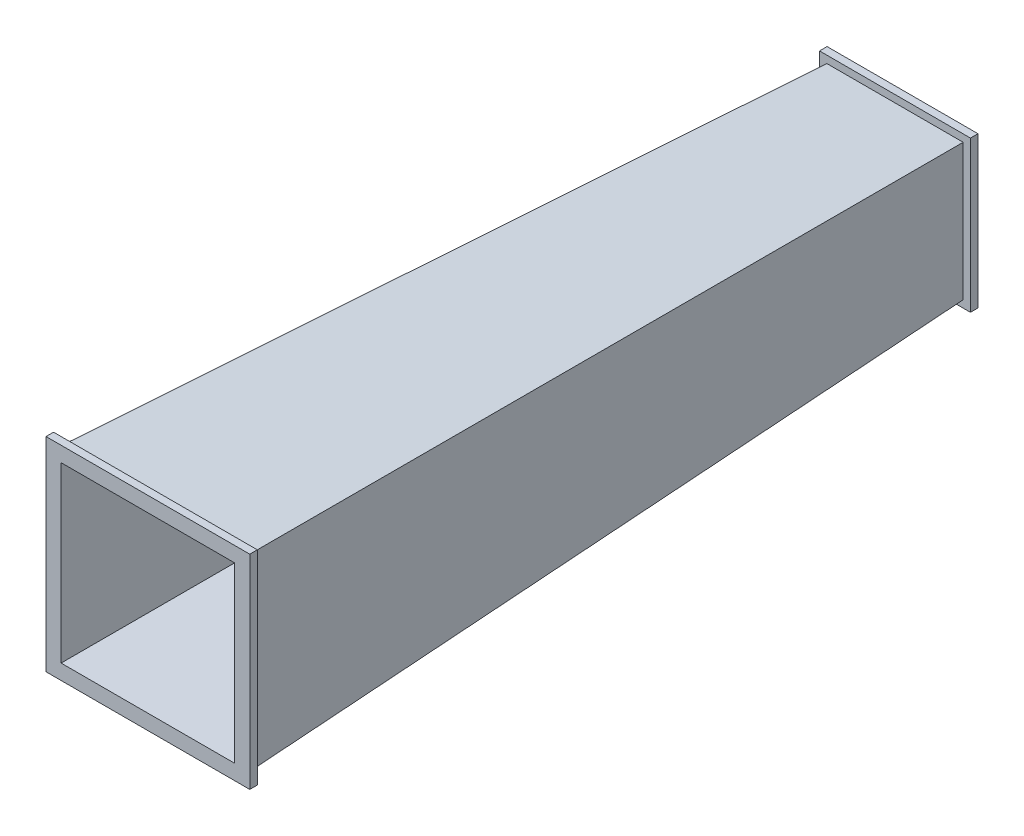
from build123d import *

# Parameters (mm, degrees)
SHELL3_T            = -5
SKETCH6_W           = 100
SKETCH6_H           = 100
SKETCH6_W_2         = 90
SKETCH6_H_2         = 90
BOSS_EXTRUDE3_DEPTH = 5
SKETCH5_W           = 135
SKETCH5_H           = 135
SKETCH5_W_2         = 114.993876874
SKETCH5_H_2         = 114.993876874
BOSS_EXTRUDE4_DEPTH = 5


with BuildPart() as part:
    # Sketch4 → Loft1 section 0
    with BuildSketch(Plane.XY.offset(500)):
        with BuildLine():
            Line((-62.5, 62.5), (62.5, 62.5))
            Line((62.5, 62.5), (62.5, -62.5))
            Line((62.5, -62.5), (-62.5, -62.5))
            Line((-62.5, -62.5), (-62.5, 62.5))
        make_face()
    # Sketch2 → Loft1 section 1
    with BuildSketch(Plane.XY):
        with BuildLine():
            Line((-45, 45), (45, 45))
            Line((45, 45), (45, -45))
            Line((45, -45), (-45, -45))
            Line((-45, -45), (-45, 45))
        make_face()
    loft()

    # Shell3
    shell3_openings = [part.faces().sort_by_distance(p)[0] for p in [
        (0, 0, 500),
        (0, 0, 0),
    ]]
    offset(amount=SHELL3_T, openings=shell3_openings, kind=Kind.INTERSECTION)

    # Sketch6 → Boss-Extrude3 (add)
    with BuildSketch(Plane(origin=(0, 0, 0), x_dir=(-1, 0, 0), z_dir=(0, 0, -1))):
        Rectangle(SKETCH6_W, SKETCH6_H)
        Rectangle(SKETCH6_W_2, SKETCH6_H_2, mode=Mode.SUBTRACT)
    extrude(amount=-BOSS_EXTRUDE3_DEPTH)

    # Sketch5 → Boss-Extrude4 (add)
    with BuildSketch(Plane.XY.offset(500)):
        Rectangle(SKETCH5_W, SKETCH5_H)
        Rectangle(SKETCH5_W_2, SKETCH5_H_2, mode=Mode.SUBTRACT)
    extrude(amount=-BOSS_EXTRUDE4_DEPTH)


solid = part.part
